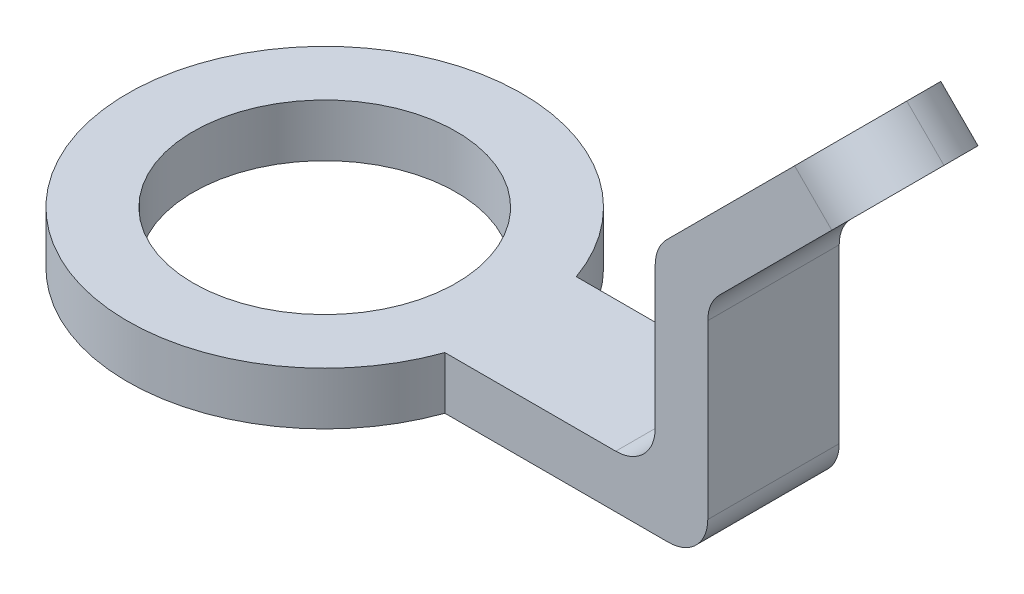
from build123d import *

# Parameters (mm, degrees)
SKETCH2_R            = 10
BOSS_EXTRUDE1_DEPTH  = 4
BOSS_EXTRUDE2_DEPTH  = 10
FILLET1_R            = 5
M3_CLEARANCE_HOLE1_D = 3.6
FILLET2_R            = 3


with BuildPart() as part:
    # Sketch2 → Boss-Extrude1 (new body)
    with BuildSketch(Plane(origin=(0, 0, 0), x_dir=(1, 0, 0), z_dir=(0, 1, 0))):
        with BuildLine():
            Line((34.142135624, 5), (34.142135624, -5))
            Line((34.142135624, -5), (14.142135624, -5))
            ThreePointArc((14.142135624, -5), (-15, 0), (14.142135624, 5))
            Line((14.142135624, 5), (34.142135624, 5))
        make_face()
        with Locations(Location((0, 0, 0), (0, 0, 270))):
            Circle(SKETCH2_R, mode=Mode.SUBTRACT)
    extrude(amount=BOSS_EXTRUDE1_DEPTH)

    # Sketch3 → Boss-Extrude2 (add)
    with BuildSketch(Plane.XY.offset(5)):
        Polygon((34.142135624, 4), (34.142135624, 17.343145751), (47.112698372, 30.313708499), (44.284271247, 33.142135624), (30.142135624, 19), (30.142135624, 4), align=None)
    extrude(amount=-BOSS_EXTRUDE2_DEPTH)

    # Fillet1
    fillet1_edges = [part.edges().sort_by_distance(p)[0] for p in [
        (45.69848481, 31.727922061, 5),
        (45.69848481, 31.727922061, -5),
    ]]
    fillet(fillet1_edges, radius=FILLET1_R - 0.0001)  # a hair under: the kernel refuses the full size

    # M3 Clearance Hole1 (through all)
    with Locations(Plane(origin=(5.571067812, -5.571067812, 0), x_dir=(0.7071067811865489, 0.7071067811865462, 0), z_dir=(-0.7071067811865462, 0.7071067811865489, 0))):
        with Locations((49.748737342, 0)):
            Hole(M3_CLEARANCE_HOLE1_D / 2)

    # Fillet2
    fillet2_edges = [part.edges().sort_by_distance(p)[0] for p in [
        (30.142135624, 4, 0),
        (30.142135624, 19, 0),
        (34.142135624, 17.343145751, 0),
        (34.142135624, 0, 0),
    ]]
    fillet(fillet2_edges, radius=FILLET2_R)


solid = part.part
